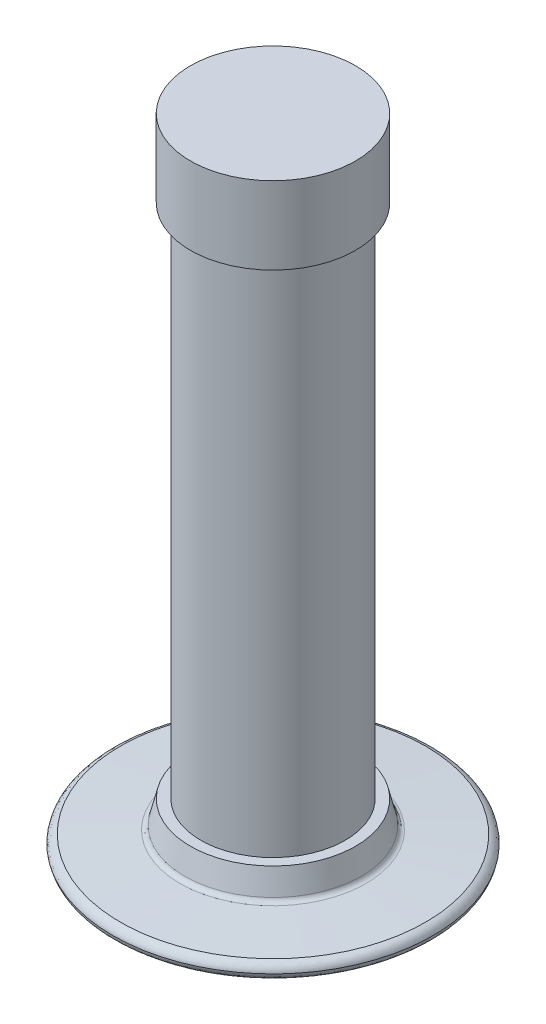
from build123d import *


with BuildPart() as part:
    # Sketch1 → Revolve1 (revolve)
    with BuildSketch(Plane.XY):
        with BuildLine():
            Line((0, 0), (0, 130))
            Line((0, 130), (16, 130))
            Line((16, 130), (16, 115))
            Line((16, 115), (14, 115))
            Line((14, 115), (14, 15))
            Line((14, 15), (16, 15))
            Line((16, 15), (17.111692668, 10.512431094))
            ThreePointArc((17.111692668, 10.512431094), (17.441933325, 9.984863822), (18.020263304, 9.754819144))
            Line((18.020263304, 9.754819144), (29.564485303, 9.036667386))
            add(Edge.make_bspline(
                [(29.564485303, 9.036667386), (30.853089791, 8.614064405), (31, 7.5)],
                knots=[0, 0, 0, 1, 1, 1], degree=2))
            add(Edge.make_bspline(
                [(29.564485303, 5.963332614), (30.853089791, 6.385935595), (31, 7.5)],
                knots=[0, 0, 0, 1, 1, 1], degree=2))
            Line((29.564485303, 5.963332614), (18.020263304, 5.245180856))
            ThreePointArc((18.020263304, 5.245180856), (17.441933325, 5.015136178), (17.111692668, 4.487568906))
            Line((17.111692668, 4.487568906), (16, 0))
            Line((16, 0), (0, 0))
        make_face()
    revolve(axis=Axis((0, 0, 0), (0, 1, 0)))


solid = part.part
